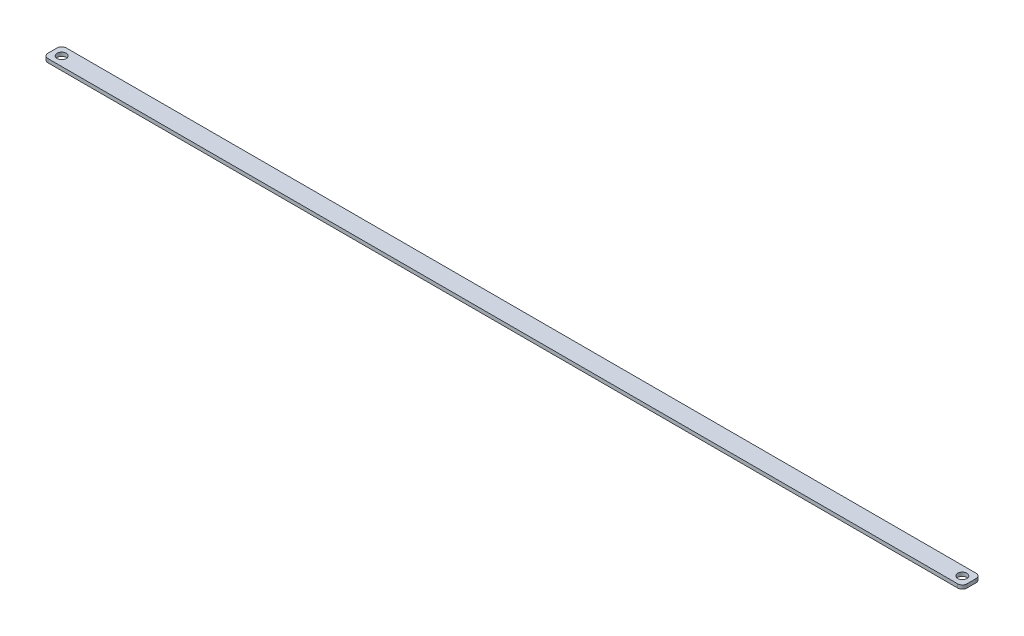
from build123d import *

# Parameters (mm, degrees)
SKETCH1_R           = 2.5
BOSS_EXTRUDE2_DEPTH = 2
FLEX1_OUTLINE_R     = 2.5
FLEX1_DEPTH         = 2


# Read off the part's stored shape, not the designer's step: Flex1
with BuildPart() as part:
    # Sketch1 → Boss-Extrude2 (new body)
    with BuildSketch(Plane(origin=(0, 0, 0), x_dir=(1, 0, 0), z_dir=(0, 1, 0))):
        with BuildLine():
            Line((2.5, 0), (47.5, 0))
            ThreePointArc((47.5, 0), (49.267766953, 0.732233047), (50, 2.5))
            Line((50, 2.5), (50, 7.5))
            ThreePointArc((50, 7.5), (49.267766953, 9.267766953), (47.5, 10))
            Line((47.5, 10), (2.5, 10))
            ThreePointArc((2.5, 10), (0.732233047, 9.267766953), (0, 7.5))
            Line((0, 7.5), (0, 2.5))
            ThreePointArc((0, 2.5), (0.732233047, 0.732233047), (2.5, 0))
        make_face()
        with Locations(Location((5, 5, 0), (0, 0, 270))):
            Circle(SKETCH1_R, mode=Mode.SUBTRACT)
        with Locations(Location((45, 5, 0), (0, 0, 270))):
            Circle(SKETCH1_R, mode=Mode.SUBTRACT)
    extrude(amount=BOSS_EXTRUDE2_DEPTH)

    # Flex1 outline → Flex1 (add)
    # profile 1 of 4: a face of its own
    with BuildSketch(Plane(origin=(0, 0, 0), x_dir=(1, 0, 0), z_dir=(0, 1, 0))):
        with BuildLine():
            Line((2.5, 10), (-217.066298, 10))
            ThreePointArc((-217.066298, 10), (-218.834064953, 9.267766953), (-219.566298, 7.5))
            Line((-219.566298, 7.5), (-219.566298, 2.5))
            ThreePointArc((-219.566298, 2.5), (-218.834064953, 0.732233047), (-217.066298, 0))
            Line((-217.066298, 0), (2.5, 0))
            ThreePointArc((2.5, 0), (0.732233047, 0.732233047), (0, 2.5))
            Line((0, 2.5), (0, 7.5))
            ThreePointArc((0, 7.5), (0.732233047, 9.267766953), (2.5, 10))
        make_face()
        with Locations((-214.566298, 5)):
            Circle(FLEX1_OUTLINE_R, mode=Mode.SUBTRACT)
    # profile 2 of 4: a face of its own
    with BuildSketch(Plane(origin=(0, 0, 0), x_dir=(1, 0, 0), z_dir=(0, 1, 0))):
        with BuildLine():
            Line((277.933702, 10), (47.5, 10))
            ThreePointArc((47.5, 10), (49.267766953, 9.267766953), (50, 7.5))
            Line((50, 7.5), (50, 2.5))
            ThreePointArc((50, 2.5), (49.267766953, 0.732233047), (47.5, 0))
            Line((47.5, 0), (277.933702, 0))
            ThreePointArc((277.933702, 0), (279.701468953, 0.732233047), (280.433702, 2.5))
            Line((280.433702, 2.5), (280.433702, 7.5))
            ThreePointArc((280.433702, 7.5), (279.701468953, 9.267766953), (277.933702, 10))
        make_face()
        with Locations((275.433702, 5)):
            Circle(FLEX1_OUTLINE_R, mode=Mode.SUBTRACT)
    # profile 3 of 4: a face of its own
    with BuildSketch(Plane(origin=(0, 0, 0), x_dir=(1, 0, 0), z_dir=(0, 1, 0))):
        with Locations((5, 5)):
            Circle(FLEX1_OUTLINE_R)
    # profile 4 of 4: a face of its own
    with BuildSketch(Plane(origin=(0, 0, 0), x_dir=(1, 0, 0), z_dir=(0, 1, 0))):
        with Locations((45, 5)):
            Circle(FLEX1_OUTLINE_R)
    extrude(amount=FLEX1_DEPTH)


solid = part.part
